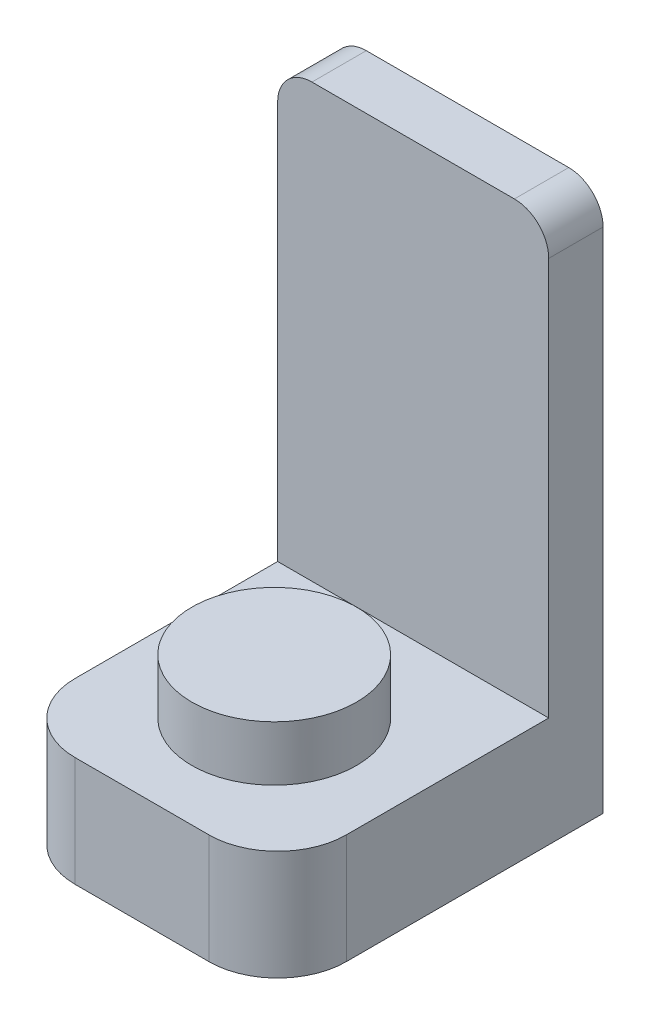
from build123d import *

# Parameters (mm, degrees)
MAINBASESKETCH_W             = 15.8
MAINBASESKETCH_H             = 3.2
MAINBASEEXTRUDE_DEPTH        = 7.9
STUDSSKETCH_R                = 2.4
STUDSEXTRUDE_DEPTH           = 1.6
STUDSPATTERN_COUNT           = 2
STUDSPATTERN_PITCH           = 8
STUDSPATTERN_COUNT_DIR2      = 2
STUDSPATTERN_PITCH_DIR2      = 8
MAINBASESHELL_T              = -1.2
LCUTBLUE_DEPTH               = 19.555463972
LCUTBLUE_DEPTH_BACK          = 19.555463972
CUTADDEDTOLCUT_DEPTH         = 2
MADESLIMCUTSKETCH_W          = 7.9
MADESLIMCUTSKETCH_H          = 7.9
MADESLIMCUT_DEPTH            = 19.897228453
MADESLIMFILLEXT_REACH        = 20.897
SKETCH33_W                   = 5.500952983
SKETCH33_H                   = 1.199047018
SHORTLEXTENSIONSKETCH_W      = 1.583745828
SHORTLEXTENSIONSKETCH_H      = 7.9
SHORTLEXTENDEDCUTSKETCH_W    = 13.4
SHORTLEXTENDEDCUTSKETCH_H    = 1.582792846
SHORTLEXTENDEDCUT_DEPTH      = 2
SHORTLUNDERSTUMPS_START      = -0.2
SHORTLUNDERSTUMPSKETCH_W     = 0.996828098
SHORTLUNDERSTUMPSKETCH_H     = 1
SHORTLUNDERSTUMPS_DEPTH      = 1.6
SHORTLUPPERCIRCLES_START     = -0.2
SHORTLUPPERCIRCLESSKETCH_R   = 2.25
SHORTLUPPERCIRCLESSKETCH_R_2 = 2
SHORTLUPPERCIRCLES_DEPTH     = 1.5
CUT_EXTRUDE17_DEPTH          = 7.9
SKETCH60_W                   = 1.205928798
SKETCH60_H                   = 7.083745828
SKETCH63_W                   = 1.583745828
SKETCH63_H                   = 7.9
LPATTERN2_START              = -2.883745828
LPATTERN2_OUTLINE_R          = 2.25
LPATTERN2_OUTLINE_R_2        = 2
LPATTERN2_DEPTH              = 1.3
FILLET4_R                    = 1
FILLET16_R                   = 2


# Read off the part's stored shape, not the designer's step: LPattern2
with BuildPart() as part:
    # MainBaseSketch → MainBaseExtrude (new, symmetric)
    with BuildSketch(Plane.XY):
        with Locations((8.581967213, 1.6)):
            Rectangle(MAINBASESKETCH_W, MAINBASESKETCH_H)
    extrude(amount=MAINBASEEXTRUDE_DEPTH, both=True)

    # StudsSketch → StudsExtrude (add)
    with BuildSketch(Plane(origin=(0, 3.2, 0), x_dir=(1, 0, 0), z_dir=(0, 1, 0))):
        with Locations((4.581967213, 4)):
            Circle(STUDSSKETCH_R)
    studsextrude = extrude(amount=STUDSEXTRUDE_DEPTH)

    # StudsPattern: StudsExtrude 2 × 2
    with Locations(*[(j * STUDSPATTERN_PITCH_DIR2, 0, i * STUDSPATTERN_PITCH) for i in range(STUDSPATTERN_COUNT) for j in range(STUDSPATTERN_COUNT_DIR2) if (i, j) != (0, 0)]):
        add(studsextrude)

    # MainBaseShell
    mainbaseshell_openings = [part.faces().sort_by_distance(p)[0] for p in [
        (8.581967213, 0, 0),
    ]]
    offset(amount=MAINBASESHELL_T, openings=mainbaseshell_openings, kind=Kind.INTERSECTION)

    # LCUTBlueSketch → LCutBlue (cut, two sides: drawn at the far end of the back side and taken through both)
    with BuildSketch(Plane(origin=(0, 3.2, 0), x_dir=(1, 0, 0), z_dir=(0, 1, 0)).offset(-LCUTBLUE_DEPTH_BACK)):
        Polygon((8.581967213, 53.229874044), (8.581967213, 7.9), (8.581967213, 0), (16.481967213, 0), (61.811841258, 0), (125.917963912, 64.106122654), (72.688089868, 117.335996699), align=None)
    extrude(amount=LCUTBLUE_DEPTH + LCUTBLUE_DEPTH_BACK, mode=Mode.SUBTRACT)

    # CutAddedtoLSketch → CutAddedToLCut (add)
    with BuildSketch(Plane.XZ):
        Polygon((7.382920196, -6.7), (8.581967213, -6.7), (8.581967213, 0), (15.281967213, 0), (15.281967213, 1.199047018), (7.382920196, 1.199047018), (7.382920196, 0), align=None)
    extrude(amount=-CUTADDEDTOLCUT_DEPTH)

    # MadeSlimCutSketch → MadeSlimCut (cut, through all)
    with BuildSketch(Plane.XZ):
        with Locations((4.631967213, -3.95)):
            Rectangle(MADESLIMCUTSKETCH_W, MADESLIMCUTSKETCH_H)
    extrude(amount=-MADESLIMCUT_DEPTH, mode=Mode.SUBTRACT)

    # Sketch33 → MadeSlimFillExt (add, up to next)
    with BuildSketch(Plane.XZ, mode=Mode.PRIVATE) as madeslimfillext_sk1:
        with Locations((4.632443704, 0.599523509)):
            Rectangle(SKETCH33_W, SKETCH33_H)
    madeslimfillext_tool1 = extrude(madeslimfillext_sk1.sketch, amount=-MADESLIMFILLEXT_REACH, mode=Mode.PRIVATE) - part.part
    add(madeslimfillext_tool1.solids().sort_by_distance((4.632444, 0, 0.599524))[0])

    # ShortLExtension: sweep along a curve in space
    with BuildLine() as shortlextension_path:
        Line((0.681967213, 3.2, 0), (16.481967213, 3.2, 0))
    # ShortLExtensionSketch → ShortLExtension (sweep)
    with BuildSketch(Plane(origin=(16.481967213, 0, 0), x_dir=(0, 0, -1), z_dir=(1, 0, 0))):
        with Locations((0.791872914, 3.95)):
            Rectangle(SHORTLEXTENSIONSKETCH_W, SHORTLEXTENSIONSKETCH_H)
    sweep(path=shortlextension_path.line)

    # ShortLExtendedCutSketch → ShortLExtendedCut (cut)
    with BuildSketch(Plane.XZ):
        with Locations((8.581967213, 0.407650595)):
            Rectangle(SHORTLEXTENDEDCUTSKETCH_W, SHORTLEXTENDEDCUTSKETCH_H)
    extrude(amount=-SHORTLEXTENDEDCUT_DEPTH, mode=Mode.SUBTRACT)

    # ShortLUnderStumpSketch → ShortLUnderStumps (add)
    with BuildSketch(Plane.XZ.offset(-2).offset(SHORTLUNDERSTUMPS_START)):
        with Locations((4.581764801, 0.116254172)):
            Rectangle(SHORTLUNDERSTUMPSKETCH_W, SHORTLUNDERSTUMPSKETCH_H)
        with Locations((8.57767054, 0.116254172)):
            Rectangle(SHORTLUNDERSTUMPSKETCH_W, SHORTLUNDERSTUMPSKETCH_H)
        with Locations((12.582169625, 0.116254172)):
            Rectangle(SHORTLUNDERSTUMPSKETCH_W, SHORTLUNDERSTUMPSKETCH_H)
    extrude(amount=SHORTLUNDERSTUMPS_DEPTH)

    # ShortLUpperCirclesSketch → ShortLUpperCircles (add)
    # profile 1 of 2: a face of its own
    with BuildSketch(Plane(origin=(0, 0, -1.583745828), x_dir=(-1, 0, 0), z_dir=(0, 0, -1)).offset(SHORTLUPPERCIRCLES_START)):
        with Locations(Location((-12.581967213, 3.95, 0), (0, 0, 90))):
            Circle(SHORTLUPPERCIRCLESSKETCH_R)
        with Locations(Location((-12.581967213, 3.95, 0), (0, 0, 90))):
            Circle(SHORTLUPPERCIRCLESSKETCH_R_2, mode=Mode.SUBTRACT)
    # profile 2 of 2: a face of its own
    with BuildSketch(Plane(origin=(0, 0, -1.583745828), x_dir=(-1, 0, 0), z_dir=(0, 0, -1)).offset(SHORTLUPPERCIRCLES_START)):
        with Locations(Location((-4.581967213, 3.95, 0), (0, 0, 270))):
            Circle(SHORTLUPPERCIRCLESSKETCH_R)
        with Locations(Location((-4.581967213, 3.95, 0), (0, 0, 270))):
            Circle(SHORTLUPPERCIRCLESSKETCH_R_2, mode=Mode.SUBTRACT)
    extrude(amount=SHORTLUPPERCIRCLES_DEPTH)

    # Sketch59 → Cut-Extrude17 (cut)
    with BuildSketch(Plane.ZY.offset(-8.581967213)):
        Polygon((-1.583745828, 6.2), (-1.583745828, 7.9), (0, 7.9), (0, 3.2), (1.6, 3.2), (1.6, 4.8), (6.4, 4.8), (6.4, 3.2), (7.9, 3.2), (7.9, 0), (-1.583745828, 0), (-1.583745828, 1.7), (-2.883745828, 1.7), (-2.883745828, 6.2), align=None)
    extrude(amount=-CUT_EXTRUDE17_DEPTH, mode=Mode.SUBTRACT)

    # Sweep4: sweep along a curve in space
    with BuildLine() as sweep4_path:
        Line((8.581967213, 0, 6.7), (8.581967213, 2, 6.7))
    # Sketch60 → Sweep4 (sweep)
    with BuildSketch(Plane(origin=(0, 0, 0), x_dir=(-1, 0, 0), z_dir=(0, -1, 0))):
        with Locations((-7.979002814, -3.158127086)):
            Rectangle(SKETCH60_W, SKETCH60_H)
    sweep(path=sweep4_path.line)

    # Sweep5: sweep along a curve in space
    with BuildLine() as sweep5_path:
        Line((0.681967213, 7.9, 0), (8.581967213, 7.9, 0))
    # Sketch63 → Sweep5 (sweep)
    with BuildSketch(Plane.ZY.offset(-0.681967213)):
        with Locations((-0.791872914, 11.85)):
            Rectangle(SKETCH63_W, SKETCH63_H)
    sweep(path=sweep5_path.line)

    # LPattern2 outline → LPattern2 (add)
    with BuildSketch(Plane.XY.offset(LPATTERN2_START)):
        with Locations((4.581967213, 11.95)):
            Circle(LPATTERN2_OUTLINE_R)
        with Locations((4.581967213, 11.95)):
            Circle(LPATTERN2_OUTLINE_R_2, mode=Mode.SUBTRACT)
    extrude(amount=LPATTERN2_DEPTH)

    # Fillet4
    fillet4_edges = [part.edges().sort_by_distance(p)[0] for p in [
        (0.681967213, 15.8, -0.791872914),
        (8.581967213, 15.8, -0.791872914),
    ]]
    fillet(fillet4_edges, radius=FILLET4_R)

    # Fillet16
    fillet16_edges = [part.edges().sort_by_distance(p)[0] for p in [
        (8.581967213, 1.6, 7.9),
        (0.681967213, 1.6, 7.9),
    ]]
    fillet(fillet16_edges, radius=FILLET16_R)


solid = part.part
